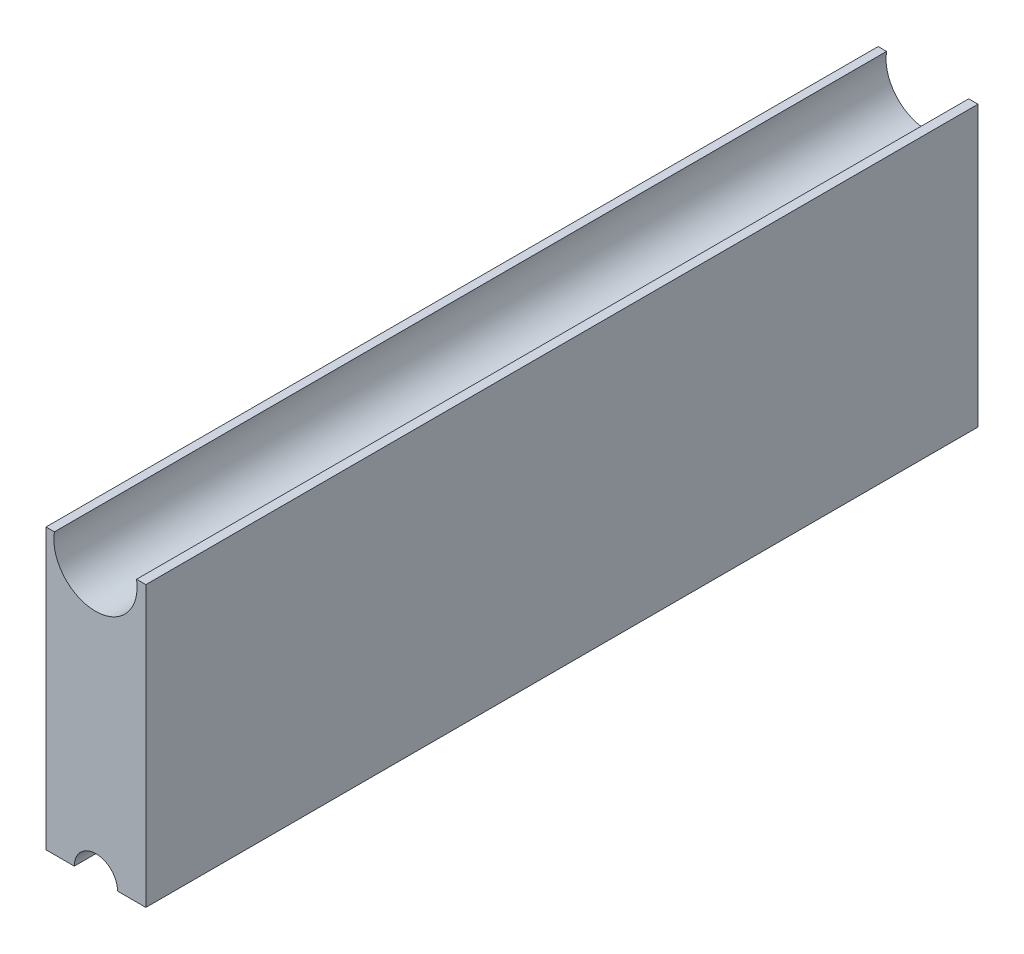
from build123d import *

# Parameters (mm, degrees)
BOSS_EXTRUDE4_DEPTH = 63.5


with BuildPart() as part:
    # Sketch1 → Boss-Extrude4 (new body)
    with BuildSketch(Plane.XY):
        with BuildLine():
            Line((-5.207, -26.162), (-5.207, -4.826))
            Line((-5.207, -4.826), (-5.916922018, -4.826))
            ThreePointArc((-5.916922018, -4.826), (-5.886260929, -5.079177957), (-5.876018538, -5.334))
            ThreePointArc((-5.876018538, -5.334), (-9.305840581, -8.498757609), (-12.185115059, -4.826))
            Line((-12.185115059, -4.826), (-12.827, -4.826))
            Line((-12.827, -4.826), (-12.827, -26.162))
            Line((-12.827, -26.162), (-10.668, -26.162))
            ThreePointArc((-10.668, -26.162), (-9.017, -24.511), (-7.366, -26.162))
            Line((-7.366, -26.162), (-5.207, -26.162))
        make_face()
    extrude(amount=BOSS_EXTRUDE4_DEPTH)


solid = part.part
